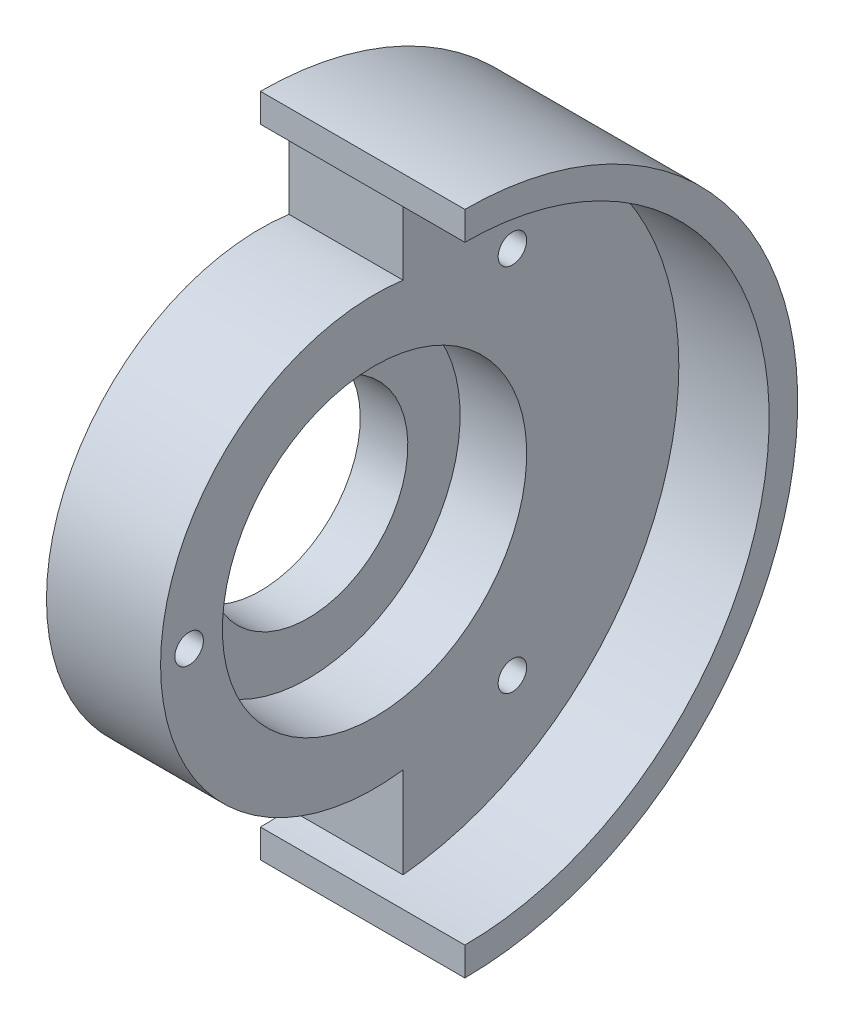
from build123d import *
from build123d.topology import SkipClean

# Parameters (mm, degrees)
CUT_EXTRUDE1_DEPTH      = 51.931326313
CUT_EXTRUDE1_DEPTH_BACK = 51.931326313
SKETCH2_R               = 1.5
SKETCH3_R               = 2.75
CUT_EXTRUDE2_DEPTH      = 5


with BuildPart() as part:
    # Sketch1 → Revolve1 (revolve)
    with BuildSketch(Plane.XY):
        Polygon((21.5, 35), (21.5, 32), (12, 32), (12, 16), (5, 16), (5, 10.5), (0, 10.5), (0, 35), align=None)
    revolve(axis=Axis((21.5, 0, 0), (-1, 0, 0)))

    # Sketch2 → Cut-Extrude1 (cut, two sides: drawn at the far end of the back side and taken through both)
    with SkipClean():  # the faces are left unmerged after this step: merging them gives an invalid solid
        with BuildSketch(Plane(origin=(12, 0, 0), x_dir=(0, 0, -1), z_dir=(1, 0, 0)).offset(-CUT_EXTRUDE1_DEPTH_BACK)):
            with Locations((-19.5, 0)):
                Circle(SKETCH2_R)
            with Locations((14.5, -19.437399517)):
                Circle(SKETCH2_R)
            with Locations((14.5, 19.437399517)):
                Circle(SKETCH2_R)
            with BuildLine():
                Line((3, 22.299103121), (3, 31.859064644))
                ThreePointArc((3, 31.859064644), (1.501654319, 31.964746742), (0, 32))
                Line((0, 32), (0, 35))
                ThreePointArc((0, 35), (-35, 0), (0, -35))
                Line((0, -35), (0, -32))
                ThreePointArc((0, -32), (1.501654319, -31.964746742), (3, -31.859064644))
                Line((3, -31.859064644), (3, -22.299103121))
                ThreePointArc((3, -22.299103121), (-22.5, 0), (3, 22.299103121))
            make_face()
        extrude(amount=CUT_EXTRUDE1_DEPTH + CUT_EXTRUDE1_DEPTH_BACK, mode=Mode.SUBTRACT)

    # Sketch3 → Cut-Extrude2 (cut)
    with SkipClean():  # the faces are left unmerged after this step: merging them gives an invalid solid
        with BuildSketch(Plane.ZY):
            with Locations((-14.5, 19.437399517)):
                Circle(SKETCH3_R)
            with Locations((19.5, 0)):
                Circle(SKETCH3_R)
            with Locations((-14.5, -19.437399517)):
                Circle(SKETCH3_R)
        extrude(amount=-CUT_EXTRUDE2_DEPTH, mode=Mode.SUBTRACT)


solid = part.part
